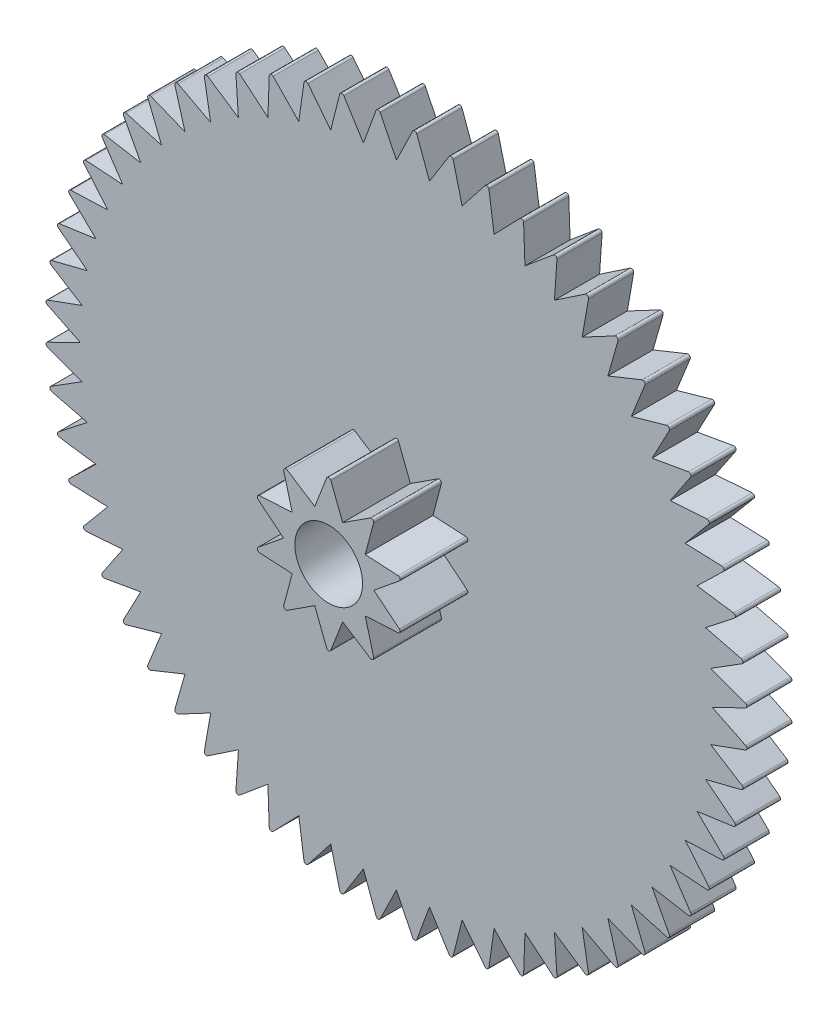
from build123d import *

# Parameters (mm, degrees)
SKETCH_1_R              = 7.85
EXTRUDE_1_DEPTH         = 1
SKETCH_2_R              = 1.75
EXTRUDE_2_DEPTH         = 1.5
SKETCH_3_R              = 0.75
CUT_EXTRUDE_3_DEPTH     = 12.379586987
CUT_EXTRUDE_START       = -1.5
SKETCH_4_R              = 1.75
CUT_EXTRUDE_4_DEPTH     = 1.5
CUT_EXTRUDE_START_2     = -1
CUT_EXTRUDE_5_OUTLINE_R = 7.85
CUT_EXTRUDE_5_DEPTH     = 1


# Read off the part's stored shape, not the designer's step: 伸長5
with BuildPart() as part:
    # 草圖1 → 伸長1 (new body)
    with BuildSketch(Plane.XY):
        Circle(SKETCH_1_R)
    extrude(amount=EXTRUDE_1_DEPTH)

    # 草圖2 → 伸長2 (add)
    with BuildSketch(Plane.XY.offset(1)):
        Circle(SKETCH_2_R)
    extrude(amount=EXTRUDE_2_DEPTH)

    # 草圖3 → 伸長3 (cut, through all)
    with BuildSketch(Plane.XY.offset(2.5)):
        Circle(SKETCH_3_R)
    extrude(amount=-CUT_EXTRUDE_3_DEPTH, mode=Mode.SUBTRACT)

    # 草圖4 → 伸長4 (cut)
    with BuildSketch(Plane.XY.offset(2.5).offset(CUT_EXTRUDE_START)):
        Circle(SKETCH_4_R)
        with BuildLine():
            Line((0.046633344, 1.6294325), (0.309016994, 0.951056516))
            Line((0.309016994, 0.951056516), (0.920029225, 1.345648976))
            ThreePointArc((0.920029225, 1.345648976), (0.976543808, 1.344097242), (0.995483561, 1.290828192))
            Line((0.995483561, 1.290828192), (0.809016994, 0.587785252))
            Line((0.809016994, 0.587785252), (1.535271901, 0.54787328))
            ThreePointArc((1.535271901, 0.54787328), (1.580081073, 0.513399462), (1.564092893, 0.459171388))
            Line((1.564092893, 0.459171388), (1, 0))
            Line((1, 0), (1.564092893, -0.459171388))
            ThreePointArc((1.564092893, -0.459171388), (1.580081073, -0.513399462), (1.535271901, -0.54787328))
            Line((1.535271901, -0.54787328), (0.809016994, -0.587785252))
            Line((0.809016994, -0.587785252), (0.995483561, -1.290828192))
            ThreePointArc((0.995483561, -1.290828192), (0.976543808, -1.344097242), (0.920029225, -1.345648976))
            Line((0.920029225, -1.345648976), (0.309016994, -0.951056516))
            Line((0.309016994, -0.951056516), (0.046633344, -1.6294325))
            ThreePointArc((0.046633344, -1.6294325), (0, -1.66139556), (-0.046633344, -1.6294325))
            Line((-0.046633344, -1.6294325), (-0.309016994, -0.951056516))
            Line((-0.309016994, -0.951056516), (-0.920029225, -1.345648976))
            ThreePointArc((-0.920029225, -1.345648976), (-0.976543808, -1.344097242), (-0.995483561, -1.290828192))
            Line((-0.995483561, -1.290828192), (-0.809016994, -0.587785252))
            Line((-0.809016994, -0.587785252), (-1.535271901, -0.54787328))
            ThreePointArc((-1.535271901, -0.54787328), (-1.580081073, -0.513399462), (-1.564092893, -0.459171388))
            Line((-1.564092893, -0.459171388), (-1, 0))
            Line((-1, 0), (-1.564092893, 0.459171388))
            ThreePointArc((-1.564092893, 0.459171388), (-1.580081073, 0.513399462), (-1.535271901, 0.54787328))
            Line((-1.535271901, 0.54787328), (-0.809016994, 0.587785252))
            Line((-0.809016994, 0.587785252), (-0.995483561, 1.290828192))
            ThreePointArc((-0.995483561, 1.290828192), (-0.976543808, 1.344097242), (-0.920029225, 1.345648976))
            Line((-0.920029225, 1.345648976), (-0.309016994, 0.951056516))
            Line((-0.309016994, 0.951056516), (-0.046633344, 1.6294325))
            ThreePointArc((-0.046633344, 1.6294325), (0, 1.66139556), (0.046633344, 1.6294325))
        make_face(mode=Mode.SUBTRACT)
    extrude(amount=CUT_EXTRUDE_4_DEPTH, mode=Mode.SUBTRACT)

    # 伸長5 outline → 伸長5 (cut)
    with BuildSketch(Plane.XY.offset(1).offset(CUT_EXTRUDE_START_2)):
        Circle(CUT_EXTRUDE_5_OUTLINE_R)
        with BuildLine():
            Line((-0.359255145, 7.733871983), (0, 7))
            Line((0, 7), (0.359255145, 7.733871983))
            ThreePointArc((0.359255145, 7.733871983), (0.406779727, 7.761819581), (0.451122645, 7.729057411))
            Line((0.451122645, 7.729057411), (0.731699243, 6.961653268))
            Line((0.731699243, 6.961653268), (1.165696862, 7.653952635))
            ThreePointArc((1.165696862, 7.653952635), (1.215882419, 7.676779461), (1.256557842, 7.639561669))
            Line((1.256557842, 7.639561669), (1.455381836, 6.847033205))
            Line((1.455381836, 6.847033205), (1.959366959, 7.49017498))
            ThreePointArc((1.959366959, 7.49017498), (2.011663647, 7.50763094), (2.048225928, 7.466365291))
            Line((2.048225928, 7.466365291), (2.163118961, 6.657395614))
            Line((2.163118961, 6.657395614), (2.731569822, 7.2443334))
            ThreePointArc((2.731569822, 7.2443334), (2.785404668, 7.256227242), (2.817453222, 7.211365852))
            Line((2.817453222, 7.211365852), (2.847156502, 6.394818203))
            Line((2.847156502, 6.394818203), (3.473845035, 6.919121388))
            ThreePointArc((3.473845035, 6.919121388), (3.528628214, 6.925322801), (3.555811909, 6.877357179))
            Line((3.555811909, 6.877357179), (3.5, 6.062177826))
            Line((3.5, 6.062177826), (4.178060074, 6.518102034))
            ThreePointArc((4.178060074, 6.518102034), (4.233191368, 6.518543073), (4.255212377, 6.467998743))
            Line((4.255212377, 6.467998743), (4.114496766, 5.663118961))
            Line((4.114496766, 5.663118961), (4.836499413, 6.04566899))
            ThreePointArc((4.836499413, 6.04566899), (4.891374794, 6.040344824), (4.907991847, 5.987775558))
            Line((4.907991847, 5.987775558), (4.683914245, 5.202013778))
            Line((4.683914245, 5.202013778), (5.441949052, 5.506998332))
            ThreePointArc((5.441949052, 5.506998332), (5.495967292, 5.495967292), (5.506998332, 5.441949052))
            Line((5.506998332, 5.441949052), (5.202013778, 4.683914245))
            Line((5.202013778, 4.683914245), (5.987775558, 4.907991847))
            ThreePointArc((5.987775558, 4.907991847), (6.040344824, 4.891374794), (6.04566899, 4.836499413))
            Line((6.04566899, 4.836499413), (5.663118961, 4.114496766))
            Line((5.663118961, 4.114496766), (6.467998743, 4.255212377))
            ThreePointArc((6.467998743, 4.255212377), (6.518543073, 4.233191368), (6.518102034, 4.178060074))
            Line((6.518102034, 4.178060074), (6.062177826, 3.5))
            Line((6.062177826, 3.5), (6.877357179, 3.555811909))
            ThreePointArc((6.877357179, 3.555811909), (6.925322801, 3.528628214), (6.919121388, 3.473845035))
            Line((6.919121388, 3.473845035), (6.394818203, 2.847156502))
            Line((6.394818203, 2.847156502), (7.211365852, 2.817453222))
            ThreePointArc((7.211365852, 2.817453222), (7.256227242, 2.785404668), (7.2443334, 2.731569822))
            Line((7.2443334, 2.731569822), (6.657395614, 2.163118961))
            Line((6.657395614, 2.163118961), (7.466365291, 2.048225928))
            ThreePointArc((7.466365291, 2.048225928), (7.50763094, 2.011663647), (7.49017498, 1.959366959))
            Line((7.49017498, 1.959366959), (6.847033205, 1.455381836))
            Line((6.847033205, 1.455381836), (7.639561669, 1.256557842))
            ThreePointArc((7.639561669, 1.256557842), (7.676779461, 1.215882419), (7.653952635, 1.165696862))
            Line((7.653952635, 1.165696862), (6.961653268, 0.731699243))
            Line((6.961653268, 0.731699243), (7.729057411, 0.451122645))
            ThreePointArc((7.729057411, 0.451122645), (7.761819581, 0.406779727), (7.733871983, 0.359255145))
            Line((7.733871983, 0.359255145), (7, 0))
            Line((7, 0), (7.733871983, -0.359255145))
            ThreePointArc((7.733871983, -0.359255145), (7.761819581, -0.406779727), (7.729057411, -0.451122645))
            Line((7.729057411, -0.451122645), (6.961653268, -0.731699243))
            Line((6.961653268, -0.731699243), (7.653952635, -1.165696862))
            ThreePointArc((7.653952635, -1.165696862), (7.676779461, -1.215882419), (7.639561669, -1.256557842))
            Line((7.639561669, -1.256557842), (6.847033205, -1.455381836))
            Line((6.847033205, -1.455381836), (7.49017498, -1.959366959))
            ThreePointArc((7.49017498, -1.959366959), (7.50763094, -2.011663647), (7.466365291, -2.048225928))
            Line((7.466365291, -2.048225928), (6.657395614, -2.163118961))
            Line((6.657395614, -2.163118961), (7.2443334, -2.731569822))
            ThreePointArc((7.2443334, -2.731569822), (7.256227242, -2.785404668), (7.211365852, -2.817453222))
            Line((7.211365852, -2.817453222), (6.394818203, -2.847156502))
            Line((6.394818203, -2.847156502), (6.919121388, -3.473845035))
            ThreePointArc((6.919121388, -3.473845035), (6.925322801, -3.528628214), (6.877357179, -3.555811909))
            Line((6.877357179, -3.555811909), (6.062177826, -3.5))
            Line((6.062177826, -3.5), (6.518102034, -4.178060074))
            ThreePointArc((6.518102034, -4.178060074), (6.518543073, -4.233191368), (6.467998743, -4.255212377))
            Line((6.467998743, -4.255212377), (5.663118961, -4.114496766))
            Line((5.663118961, -4.114496766), (6.04566899, -4.836499413))
            ThreePointArc((6.04566899, -4.836499413), (6.040344824, -4.891374794), (5.987775558, -4.907991847))
            Line((5.987775558, -4.907991847), (5.202013778, -4.683914245))
            Line((5.202013778, -4.683914245), (5.506998332, -5.441949052))
            ThreePointArc((5.506998332, -5.441949052), (5.495967292, -5.495967292), (5.441949052, -5.506998332))
            Line((5.441949052, -5.506998332), (4.683914245, -5.202013778))
            Line((4.683914245, -5.202013778), (4.907991847, -5.987775558))
            ThreePointArc((4.907991847, -5.987775558), (4.891374794, -6.040344824), (4.836499413, -6.04566899))
            Line((4.836499413, -6.04566899), (4.114496766, -5.663118961))
            Line((4.114496766, -5.663118961), (4.255212377, -6.467998743))
            ThreePointArc((4.255212377, -6.467998743), (4.233191368, -6.518543073), (4.178060074, -6.518102034))
            Line((4.178060074, -6.518102034), (3.5, -6.062177826))
            Line((3.5, -6.062177826), (3.555811909, -6.877357179))
            ThreePointArc((3.555811909, -6.877357179), (3.528628214, -6.925322801), (3.473845035, -6.919121388))
            Line((3.473845035, -6.919121388), (2.847156502, -6.394818203))
            Line((2.847156502, -6.394818203), (2.817453222, -7.211365852))
            ThreePointArc((2.817453222, -7.211365852), (2.785404668, -7.256227242), (2.731569822, -7.2443334))
            Line((2.731569822, -7.2443334), (2.163118961, -6.657395614))
            Line((2.163118961, -6.657395614), (2.048225928, -7.466365291))
            ThreePointArc((2.048225928, -7.466365291), (2.011663647, -7.50763094), (1.959366959, -7.49017498))
            Line((1.959366959, -7.49017498), (1.455381836, -6.847033205))
            Line((1.455381836, -6.847033205), (1.256557842, -7.639561669))
            ThreePointArc((1.256557842, -7.639561669), (1.215882419, -7.676779461), (1.165696862, -7.653952635))
            Line((1.165696862, -7.653952635), (0.731699243, -6.961653268))
            Line((0.731699243, -6.961653268), (0.451122645, -7.729057411))
            ThreePointArc((0.451122645, -7.729057411), (0.406779727, -7.761819581), (0.359255145, -7.733871983))
            Line((0.359255145, -7.733871983), (0, -7))
            Line((0, -7), (-0.359255145, -7.733871983))
            ThreePointArc((-0.359255145, -7.733871983), (-0.406779727, -7.761819581), (-0.451122645, -7.729057411))
            Line((-0.451122645, -7.729057411), (-0.731699243, -6.961653268))
            Line((-0.731699243, -6.961653268), (-1.165696862, -7.653952635))
            ThreePointArc((-1.165696862, -7.653952635), (-1.215882419, -7.676779461), (-1.256557842, -7.639561669))
            Line((-1.256557842, -7.639561669), (-1.455381836, -6.847033205))
            Line((-1.455381836, -6.847033205), (-1.959366959, -7.49017498))
            ThreePointArc((-1.959366959, -7.49017498), (-2.011663647, -7.50763094), (-2.048225928, -7.466365291))
            Line((-2.048225928, -7.466365291), (-2.163118961, -6.657395614))
            Line((-2.163118961, -6.657395614), (-2.731569822, -7.2443334))
            ThreePointArc((-2.731569822, -7.2443334), (-2.785404668, -7.256227242), (-2.817453222, -7.211365852))
            Line((-2.817453222, -7.211365852), (-2.847156502, -6.394818203))
            Line((-2.847156502, -6.394818203), (-3.473845035, -6.919121388))
            ThreePointArc((-3.473845035, -6.919121388), (-3.528628214, -6.925322801), (-3.555811909, -6.877357179))
            Line((-3.555811909, -6.877357179), (-3.5, -6.062177826))
            Line((-3.5, -6.062177826), (-4.178060074, -6.518102034))
            ThreePointArc((-4.178060074, -6.518102034), (-4.233191368, -6.518543073), (-4.255212377, -6.467998743))
            Line((-4.255212377, -6.467998743), (-4.114496766, -5.663118961))
            Line((-4.114496766, -5.663118961), (-4.836499413, -6.04566899))
            ThreePointArc((-4.836499413, -6.04566899), (-4.891374794, -6.040344824), (-4.907991847, -5.987775558))
            Line((-4.907991847, -5.987775558), (-4.683914245, -5.202013778))
            Line((-4.683914245, -5.202013778), (-5.441949052, -5.506998332))
            ThreePointArc((-5.441949052, -5.506998332), (-5.495967292, -5.495967292), (-5.506998332, -5.441949052))
            Line((-5.506998332, -5.441949052), (-5.202013778, -4.683914245))
            Line((-5.202013778, -4.683914245), (-5.987775558, -4.907991847))
            ThreePointArc((-5.987775558, -4.907991847), (-6.040344824, -4.891374794), (-6.04566899, -4.836499413))
            Line((-6.04566899, -4.836499413), (-5.663118961, -4.114496766))
            Line((-5.663118961, -4.114496766), (-6.467998743, -4.255212377))
            ThreePointArc((-6.467998743, -4.255212377), (-6.518543073, -4.233191368), (-6.518102034, -4.178060074))
            Line((-6.518102034, -4.178060074), (-6.062177826, -3.5))
            Line((-6.062177826, -3.5), (-6.877357179, -3.555811909))
            ThreePointArc((-6.877357179, -3.555811909), (-6.925322801, -3.528628214), (-6.919121388, -3.473845035))
            Line((-6.919121388, -3.473845035), (-6.394818203, -2.847156502))
            Line((-6.394818203, -2.847156502), (-7.211365852, -2.817453222))
            ThreePointArc((-7.211365852, -2.817453222), (-7.256227242, -2.785404668), (-7.2443334, -2.731569822))
            Line((-7.2443334, -2.731569822), (-6.657395614, -2.163118961))
            Line((-6.657395614, -2.163118961), (-7.466365291, -2.048225928))
            ThreePointArc((-7.466365291, -2.048225928), (-7.50763094, -2.011663647), (-7.49017498, -1.959366959))
            Line((-7.49017498, -1.959366959), (-6.847033205, -1.455381836))
            Line((-6.847033205, -1.455381836), (-7.639561669, -1.256557842))
            ThreePointArc((-7.639561669, -1.256557842), (-7.676779461, -1.215882419), (-7.653952635, -1.165696862))
            Line((-7.653952635, -1.165696862), (-6.961653268, -0.731699243))
            Line((-6.961653268, -0.731699243), (-7.729057411, -0.451122645))
            ThreePointArc((-7.729057411, -0.451122645), (-7.761819581, -0.406779727), (-7.733871983, -0.359255145))
            Line((-7.733871983, -0.359255145), (-7, 0))
            Line((-7, 0), (-7.733871983, 0.359255145))
            ThreePointArc((-7.733871983, 0.359255145), (-7.761819581, 0.406779727), (-7.729057411, 0.451122645))
            Line((-7.729057411, 0.451122645), (-6.961653268, 0.731699243))
            Line((-6.961653268, 0.731699243), (-7.653952635, 1.165696862))
            ThreePointArc((-7.653952635, 1.165696862), (-7.676779461, 1.215882419), (-7.639561669, 1.256557842))
            Line((-7.639561669, 1.256557842), (-6.847033205, 1.455381836))
            Line((-6.847033205, 1.455381836), (-7.49017498, 1.959366959))
            ThreePointArc((-7.49017498, 1.959366959), (-7.50763094, 2.011663647), (-7.466365291, 2.048225928))
            Line((-7.466365291, 2.048225928), (-6.657395614, 2.163118961))
            Line((-6.657395614, 2.163118961), (-7.2443334, 2.731569822))
            ThreePointArc((-7.2443334, 2.731569822), (-7.256227242, 2.785404668), (-7.211365852, 2.817453222))
            Line((-7.211365852, 2.817453222), (-6.394818203, 2.847156502))
            Line((-6.394818203, 2.847156502), (-6.919121388, 3.473845035))
            ThreePointArc((-6.919121388, 3.473845035), (-6.925322801, 3.528628214), (-6.877357179, 3.555811909))
            Line((-6.877357179, 3.555811909), (-6.062177826, 3.5))
            Line((-6.062177826, 3.5), (-6.518102034, 4.178060074))
            ThreePointArc((-6.518102034, 4.178060074), (-6.518543073, 4.233191368), (-6.467998743, 4.255212377))
            Line((-6.467998743, 4.255212377), (-5.663118961, 4.114496766))
            Line((-5.663118961, 4.114496766), (-6.04566899, 4.836499413))
            ThreePointArc((-6.04566899, 4.836499413), (-6.040344824, 4.891374794), (-5.987775558, 4.907991847))
            Line((-5.987775558, 4.907991847), (-5.202013778, 4.683914245))
            Line((-5.202013778, 4.683914245), (-5.506998332, 5.441949052))
            ThreePointArc((-5.506998332, 5.441949052), (-5.495967292, 5.495967292), (-5.441949052, 5.506998332))
            Line((-5.441949052, 5.506998332), (-4.683914245, 5.202013778))
            Line((-4.683914245, 5.202013778), (-4.907991847, 5.987775558))
            ThreePointArc((-4.907991847, 5.987775558), (-4.891374794, 6.040344824), (-4.836499413, 6.04566899))
            Line((-4.836499413, 6.04566899), (-4.114496766, 5.663118961))
            Line((-4.114496766, 5.663118961), (-4.255212377, 6.467998743))
            ThreePointArc((-4.255212377, 6.467998743), (-4.233191368, 6.518543073), (-4.178060074, 6.518102034))
            Line((-4.178060074, 6.518102034), (-3.5, 6.062177826))
            Line((-3.5, 6.062177826), (-3.555811909, 6.877357179))
            ThreePointArc((-3.555811909, 6.877357179), (-3.528628214, 6.925322801), (-3.473845035, 6.919121388))
            Line((-3.473845035, 6.919121388), (-2.847156502, 6.394818203))
            Line((-2.847156502, 6.394818203), (-2.817453222, 7.211365852))
            ThreePointArc((-2.817453222, 7.211365852), (-2.785404668, 7.256227242), (-2.731569822, 7.2443334))
            Line((-2.731569822, 7.2443334), (-2.163118961, 6.657395614))
            Line((-2.163118961, 6.657395614), (-2.048225928, 7.466365291))
            ThreePointArc((-2.048225928, 7.466365291), (-2.011663647, 7.50763094), (-1.959366959, 7.49017498))
            Line((-1.959366959, 7.49017498), (-1.455381836, 6.847033205))
            Line((-1.455381836, 6.847033205), (-1.256557842, 7.639561669))
            ThreePointArc((-1.256557842, 7.639561669), (-1.215882419, 7.676779461), (-1.165696862, 7.653952635))
            Line((-1.165696862, 7.653952635), (-0.731699243, 6.961653268))
            Line((-0.731699243, 6.961653268), (-0.451122645, 7.729057411))
            ThreePointArc((-0.451122645, 7.729057411), (-0.406779727, 7.761819581), (-0.359255145, 7.733871983))
        make_face(mode=Mode.SUBTRACT)
    extrude(amount=CUT_EXTRUDE_5_DEPTH, mode=Mode.SUBTRACT)


solid = part.part
